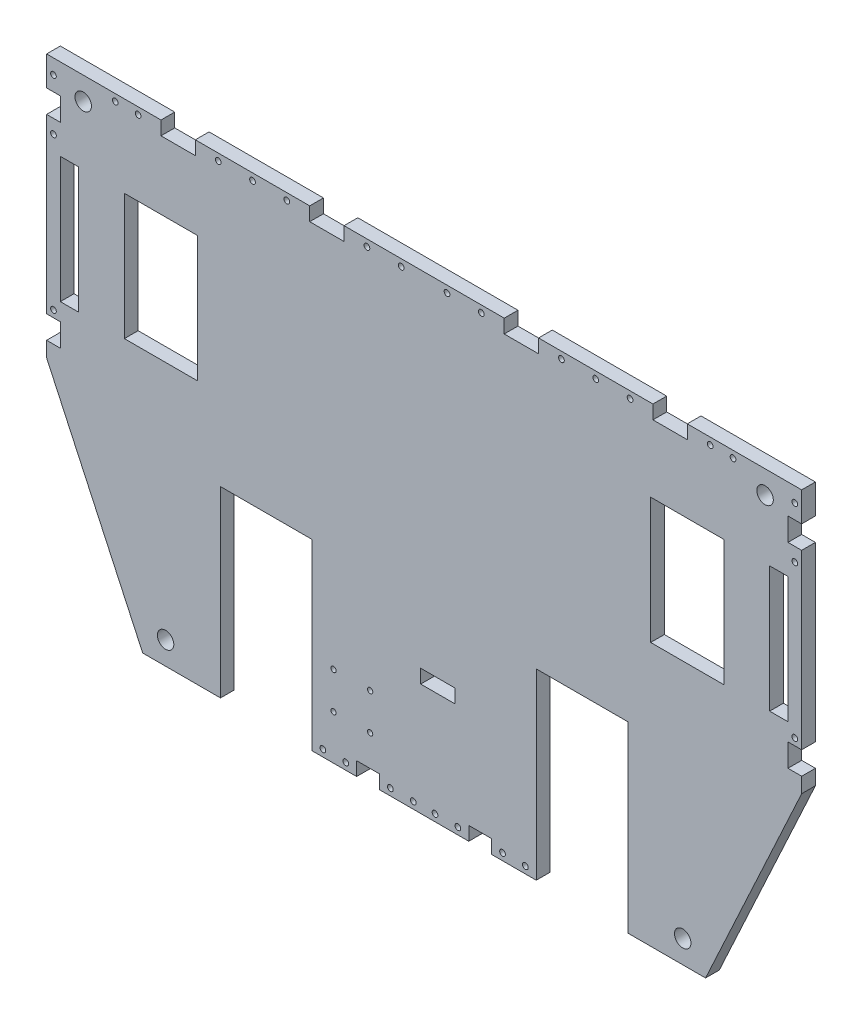
from build123d import *

# Parameters (mm, degrees)
ESQUISSE1_R             = 1.15
ESQUISSE1_W             = 15
ESQUISSE1_H             = 6
BOSS_EXTRU_1_DEPTH      = 6
ESQUISSE2_R             = 3.6
ESQUISSE2_W             = 8
ESQUISSE2_H             = 55
ESQUISSE2_W_2           = 32
ESQUISSE2_W_3           = 40
ESQUISSE2_H_2           = 80
ENL_V_MAT_EXTRU_1_DEPTH = 6
ESQUISSE3_W             = 6
ESQUISSE3_H             = 10
ESQUISSE3_W_2           = 10
ESQUISSE3_H_2           = 6
ESQUISSE3_W_3           = 15
ENL_V_MAT_EXTRU_2_DEPTH = 6
ESQUISSE4_R             = 1.25
ENL_V_MAT_EXTRU_3_DEPTH = 6


with BuildPart() as part:
    # Esquisse1 → Boss.-Extru.1 (new body)
    with BuildSketch(Plane.XY):
        Polygon((-165, 96.73), (165, 96.73), (165, -18.27), (123, -109.022410436), (-123, -109.022410436), (-165, -18.27), align=None)
        with Locations((-23.6, -89.522410436)):
            Circle(ESQUISSE1_R, mode=Mode.SUBTRACT)
        with Locations((-23.6, -73.522410436)):
            Circle(ESQUISSE1_R, mode=Mode.SUBTRACT)
        with Locations((-39.6, -89.522410436)):
            Circle(ESQUISSE1_R, mode=Mode.SUBTRACT)
        with Locations((-39.6, -73.522410436)):
            Circle(ESQUISSE1_R, mode=Mode.SUBTRACT)
        with Locations((6, -57.022410436)):
            Rectangle(ESQUISSE1_W, ESQUISSE1_H, mode=Mode.SUBTRACT)
    extrude(amount=BOSS_EXTRU_1_DEPTH)

    # Esquisse2 → Enlèv. mat.-Extru.1 (cut)
    with BuildSketch(Plane.XY.offset(6)):
        with Locations((149, 86.73)):
            Circle(ESQUISSE2_R)
        with Locations((113, -99.022410436)):
            Circle(ESQUISSE2_R)
        with Locations((-149, 86.73)):
            Circle(ESQUISSE2_R)
        with Locations((-113, -99.022410436)):
            Circle(ESQUISSE2_R)
        with Locations((-155, 33.477589564)):
            Rectangle(ESQUISSE2_W, ESQUISSE2_H)
        with Locations((-115, 33.477589564)):
            Rectangle(ESQUISSE2_W_2, ESQUISSE2_H)
        with Locations((115, 33.477589564)):
            Rectangle(ESQUISSE2_W_2, ESQUISSE2_H)
        with Locations((155, 33.477589564)):
            Rectangle(ESQUISSE2_W, ESQUISSE2_H)
        with Locations((69, -69.022410436)):
            Rectangle(ESQUISSE2_W_3, ESQUISSE2_H_2)
        with Locations((-69, -69.022410436)):
            Rectangle(ESQUISSE2_W_3, ESQUISSE2_H_2)
    extrude(amount=-ENL_V_MAT_EXTRU_1_DEPTH, mode=Mode.SUBTRACT)

    # Esquisse3 → Enlèv. mat.-Extru.2 (cut)
    with BuildSketch(Plane(origin=(0, 0, 0), x_dir=(-1, 0, 0), z_dir=(0, 0, -1))):
        with Locations((162, -6.645)):
            Rectangle(ESQUISSE3_W, ESQUISSE3_H)
        with Locations((162, 78.852589564)):
            Rectangle(ESQUISSE3_W, ESQUISSE3_H)
        with Locations((24.5, -106.022410436)):
            Rectangle(ESQUISSE3_W_2, ESQUISSE3_H_2)
        with Locations((-24.5, -106.022410436)):
            Rectangle(ESQUISSE3_W_2, ESQUISSE3_H_2)
        with Locations((-162, 78.852589564)):
            Rectangle(ESQUISSE3_W, ESQUISSE3_H)
        with Locations((-162, -6.645)):
            Rectangle(ESQUISSE3_W, ESQUISSE3_H)
        with Locations((107.5, 93.73)):
            Rectangle(ESQUISSE3_W_3, ESQUISSE3_H_2)
        with Locations((-42.5, 93.73)):
            Rectangle(ESQUISSE3_W_3, ESQUISSE3_H_2)
        with Locations((42.5, 93.73)):
            Rectangle(ESQUISSE3_W_3, ESQUISSE3_H_2)
        with Locations((-107.5, 93.73)):
            Rectangle(ESQUISSE3_W_3, ESQUISSE3_H_2)
    extrude(amount=-ENL_V_MAT_EXTRU_2_DEPTH, mode=Mode.SUBTRACT)

    # Esquisse4 → Enlèv. mat.-Extru.3 (cut)
    with BuildSketch(Plane(origin=(0, 0, 0), x_dir=(-1, 0, 0), z_dir=(0, 0, -1))):
        with Locations((162, 1.355)):
            Circle(ESQUISSE4_R)
        with Locations((162, 67.852589564)):
            Circle(ESQUISSE4_R)
        with Locations((162, 90.29)):
            Circle(ESQUISSE4_R)
        with Locations((44.25, -106.022410436)):
            Circle(ESQUISSE4_R)
        with Locations((14.75, -106.022410436)):
            Circle(ESQUISSE4_R)
        with Locations((4.75, -106.022410436)):
            Circle(ESQUISSE4_R)
        with Locations((34.249651607, -106.022410436)):
            Circle(ESQUISSE4_R)
        with Locations((135, 93.73)):
            Circle(ESQUISSE4_R)
        with Locations((125, 93.73)):
            Circle(ESQUISSE4_R)
        with Locations((90, 93.73)):
            Circle(ESQUISSE4_R)
        with Locations((75, 93.73)):
            Circle(ESQUISSE4_R)
        with Locations((60, 93.73)):
            Circle(ESQUISSE4_R)
        with Locations((25, 93.73)):
            Circle(ESQUISSE4_R)
        with Locations((10, 93.73)):
            Circle(ESQUISSE4_R)
        with Locations((-10, 93.73)):
            Circle(ESQUISSE4_R)
        with Locations((-25, 93.73)):
            Circle(ESQUISSE4_R)
        with Locations((-60, 93.73)):
            Circle(ESQUISSE4_R)
        with Locations((-75, 93.73)):
            Circle(ESQUISSE4_R)
        with Locations((-90, 93.73)):
            Circle(ESQUISSE4_R)
        with Locations((-125, 93.73)):
            Circle(ESQUISSE4_R)
        with Locations((-135, 93.73)):
            Circle(ESQUISSE4_R)
        with Locations((-34.249651607, -106.022410436)):
            Circle(ESQUISSE4_R)
        with Locations((-4.75, -106.022410436)):
            Circle(ESQUISSE4_R)
        with Locations((-14.75, -106.022410436)):
            Circle(ESQUISSE4_R)
        with Locations((-44.25, -106.022410436)):
            Circle(ESQUISSE4_R)
        with Locations((-162, 90.29)):
            Circle(ESQUISSE4_R)
        with Locations((-162, 67.852589564)):
            Circle(ESQUISSE4_R)
        with Locations((-162, 1.355)):
            Circle(ESQUISSE4_R)
    extrude(amount=-ENL_V_MAT_EXTRU_3_DEPTH, mode=Mode.SUBTRACT)


solid = part.part
